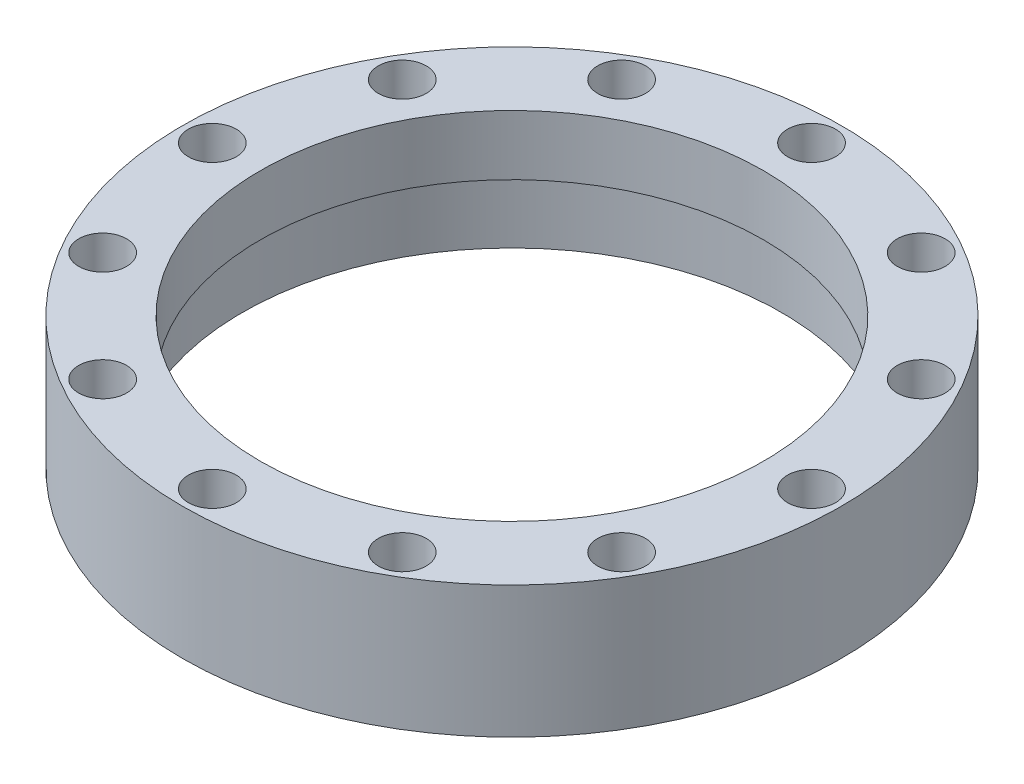
from build123d import *

# Parameters (mm, degrees)
SKETCH1_R           = 27.5
SKETCH1_R_2         = 22.5
SKETCH1_R_3         = 1.5
BOSS_EXTRUDE1_DEPTH = 11
BOSS_EXTRUDE2_START = -5
SKETCH2_R           = 22.5
SKETCH2_R_2         = 21
BOSS_EXTRUDE2_DEPTH = 5
SKETCH3_R           = 2
CUT_EXTRUDE1_DEPTH  = 5


with BuildPart() as part:
    # Sketch1 → Boss-Extrude1 (new body)
    with BuildSketch(Plane(origin=(0, 0, 0), x_dir=(1, 0, 0), z_dir=(0, 1, 0))):
        Circle(SKETCH1_R)
        Circle(SKETCH1_R_2, mode=Mode.SUBTRACT)
        with Locations((0, 25)):
            Circle(SKETCH1_R_3, mode=Mode.SUBTRACT)
        with Locations((12.5, 21.650635095)):
            Circle(SKETCH1_R_3, mode=Mode.SUBTRACT)
        with Locations((21.650635095, 12.5)):
            Circle(SKETCH1_R_3, mode=Mode.SUBTRACT)
        with Locations((25, 0)):
            Circle(SKETCH1_R_3, mode=Mode.SUBTRACT)
        with Locations((21.650635095, -12.5)):
            Circle(SKETCH1_R_3, mode=Mode.SUBTRACT)
        with Locations((12.5, -21.650635095)):
            Circle(SKETCH1_R_3, mode=Mode.SUBTRACT)
        with Locations((0, -25)):
            Circle(SKETCH1_R_3, mode=Mode.SUBTRACT)
        with Locations((-12.5, -21.650635095)):
            Circle(SKETCH1_R_3, mode=Mode.SUBTRACT)
        with Locations((-21.650635095, -12.5)):
            Circle(SKETCH1_R_3, mode=Mode.SUBTRACT)
        with Locations((-25, 0)):
            Circle(SKETCH1_R_3, mode=Mode.SUBTRACT)
        with Locations((-21.650635095, 12.5)):
            Circle(SKETCH1_R_3, mode=Mode.SUBTRACT)
        with Locations((-12.5, 21.650635095)):
            Circle(SKETCH1_R_3, mode=Mode.SUBTRACT)
    extrude(amount=BOSS_EXTRUDE1_DEPTH)

    # Sketch2 → Boss-Extrude2 (add)
    with BuildSketch(Plane(origin=(0, 11, 0), x_dir=(1, 0, 0), z_dir=(0, 1, 0)).offset(BOSS_EXTRUDE2_START)):
        Circle(SKETCH2_R)
        Circle(SKETCH2_R_2, mode=Mode.SUBTRACT)
    extrude(amount=BOSS_EXTRUDE2_DEPTH)

    # Sketch3 → Cut-Extrude1 (cut)
    with BuildSketch(Plane(origin=(0, 11, 0), x_dir=(1, 0, 0), z_dir=(0, 1, 0))):
        with Locations((0, 25)):
            Circle(SKETCH3_R)
        with Locations((12.5, 21.650635095)):
            Circle(SKETCH3_R)
        with Locations((21.650635095, 12.5)):
            Circle(SKETCH3_R)
        with Locations((25, 0)):
            Circle(SKETCH3_R)
        with Locations((21.650635095, -12.5)):
            Circle(SKETCH3_R)
        with Locations((12.5, -21.650635095)):
            Circle(SKETCH3_R)
        with Locations((0, -25)):
            Circle(SKETCH3_R)
        with Locations((-12.5, -21.650635095)):
            Circle(SKETCH3_R)
        with Locations((-21.650635095, -12.5)):
            Circle(SKETCH3_R)
        with Locations((-25, 0)):
            Circle(SKETCH3_R)
        with Locations((-21.650635095, 12.5)):
            Circle(SKETCH3_R)
        with Locations((-12.5, 21.650635095)):
            Circle(SKETCH3_R)
    extrude(amount=-CUT_EXTRUDE1_DEPTH, mode=Mode.SUBTRACT)


solid = part.part
